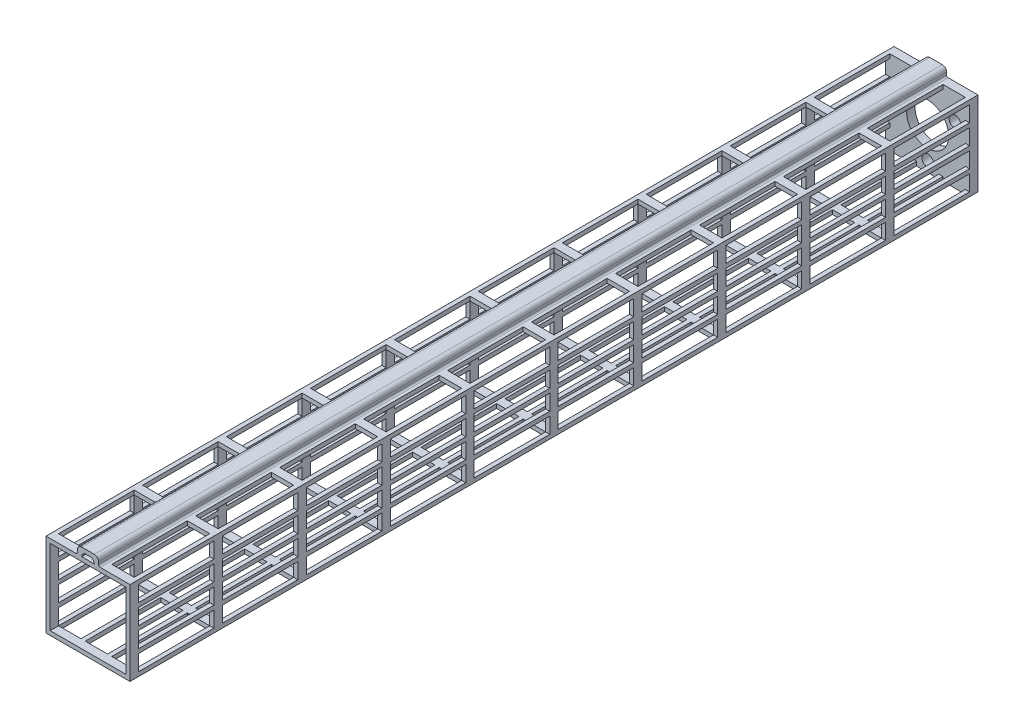
from build123d import *

# Parameters (mm, degrees)
SKETCH1_R           = 1.778
SKETCH1_R_2         = 6.35
BOSS_EXTRUDE1_DEPTH = 2.54
SKETCH2_W           = 1.27
SKETCH2_H           = 1.27
BOSS_EXTRUDE2_DEPTH = 254
FILLET1_R           = 1.27
FILLET2_R           = 0.508
SKETCH8_W           = 3.81
SKETCH8_H           = 2.54
CUT_EXTRUDE1_DEPTH  = 258.305886446
SKETCH7_W           = 25.4
SKETCH7_H           = 25.4
SKETCH7_W_2         = 22.86
SKETCH7_H_2         = 22.86
BOSS_EXTRUDE6_DEPTH = 2.54
FILLET3_R           = 1.27
LPATTERN1_COUNT     = 10
LPATTERN1_PITCH     = 25.4


with BuildPart() as part:
    # Sketch1 → Boss-Extrude1 (new body)
    with BuildSketch(Plane.XY):
        Polygon((-12.7, -12.7), (12.7, -12.7), (12.7, 12.7), (3.175, 12.7), (3.175, 15.24), (-3.175, 15.24), (-3.175, 12.7), (-12.7, 12.7), align=None)
        with Locations((0, -9.525)):
            Circle(SKETCH1_R, mode=Mode.SUBTRACT)
        with Locations((-8.248891971, 4.7625)):
            Circle(SKETCH1_R, mode=Mode.SUBTRACT)
        with Locations((8.248891971, 4.7625)):
            Circle(SKETCH1_R, mode=Mode.SUBTRACT)
        Circle(SKETCH1_R_2, mode=Mode.SUBTRACT)
    extrude(amount=BOSS_EXTRUDE1_DEPTH)

    # Sketch2 → Boss-Extrude2 (add)
    with BuildSketch(Plane.XY.offset(2.54)):
        Polygon((-4.656666667, 12.7), (-3.386666667, 12.7), (-3.175, 12.7), (-3.175, 15.24), (3.175, 15.24), (3.175, 12.7), (3.386666667, 12.7), (4.656666667, 12.7), (4.656666667, 11.43), (3.386666667, 11.43), (-3.386666667, 11.43), (-4.656666667, 11.43), align=None)
        with Locations((-12.065, 12.065)):
            Rectangle(SKETCH2_W, SKETCH2_H)
        with Locations((12.065, 12.065)):
            Rectangle(SKETCH2_W, SKETCH2_H)
        with Locations((12.065, 6.0325)):
            Rectangle(SKETCH2_W, SKETCH2_H)
        with Locations((12.065, 0)):
            Rectangle(SKETCH2_W, SKETCH2_H)
        with Locations((12.065, -6.0325)):
            Rectangle(SKETCH2_W, SKETCH2_H)
        with Locations((-4.021666667, -12.065)):
            Rectangle(SKETCH2_W, SKETCH2_H)
        with Locations((4.021666667, -12.065)):
            Rectangle(SKETCH2_W, SKETCH2_H)
        with Locations((12.065, -12.065)):
            Rectangle(SKETCH2_W, SKETCH2_H)
        with Locations((-12.065, 6.0325)):
            Rectangle(SKETCH2_W, SKETCH2_H)
        with Locations((-12.065, 0)):
            Rectangle(SKETCH2_W, SKETCH2_H)
        with Locations((-12.065, -6.0325)):
            Rectangle(SKETCH2_W, SKETCH2_H)
        with Locations((-12.065, -12.065)):
            Rectangle(SKETCH2_W, SKETCH2_H)
    extrude(amount=BOSS_EXTRUDE2_DEPTH)

    # Fillet1
    fillet1_edges = [part.edges().sort_by_distance(p)[0] for p in [
        (-3.175, 15.24, 128.27),
        (3.175, 15.24, 128.27),
    ]]
    fillet(fillet1_edges, radius=FILLET1_R)

    # Fillet2
    fillet2_edges = [part.edges().sort_by_distance(p)[0] for p in [
        (-3.175, 12.7, 128.27),
        (3.175, 12.7, 128.27),
    ]]
    fillet(fillet2_edges, radius=FILLET2_R)

    # Sketch8 → Cut-Extrude1 (cut, through all)
    with BuildSketch(Plane.XY.offset(256.54)):
        with Locations((0, 12.7)):
            Rectangle(SKETCH8_W, SKETCH8_H)
    extrude(amount=-CUT_EXTRUDE1_DEPTH, mode=Mode.SUBTRACT)

    # Sketch7 → Boss-Extrude6 (add)
    with BuildSketch(Plane.XY.offset(256.54)):
        Rectangle(SKETCH7_W, SKETCH7_H)
        Rectangle(SKETCH7_W_2, SKETCH7_H_2, mode=Mode.SUBTRACT)
    boss_extrude6 = extrude(amount=-BOSS_EXTRUDE6_DEPTH)

    # Fillet3
    fillet3_edges = [part.edges().sort_by_distance(p)[0] for p in [
        (-1.905, 11.43, 128.27),
        (1.905, 11.43, 128.27),
        (1.905, 13.97, 128.27),
        (-1.905, 13.97, 128.27),
    ]]
    fillet(fillet3_edges, radius=FILLET3_R - 0.0001)  # a hair under: the kernel refuses the full size

    # LPattern1: Boss-Extrude6 ×10
    with Locations(*[(0, 0, -i * LPATTERN1_PITCH) for i in range(1, LPATTERN1_COUNT)]):
        add(boss_extrude6)


solid = part.part
